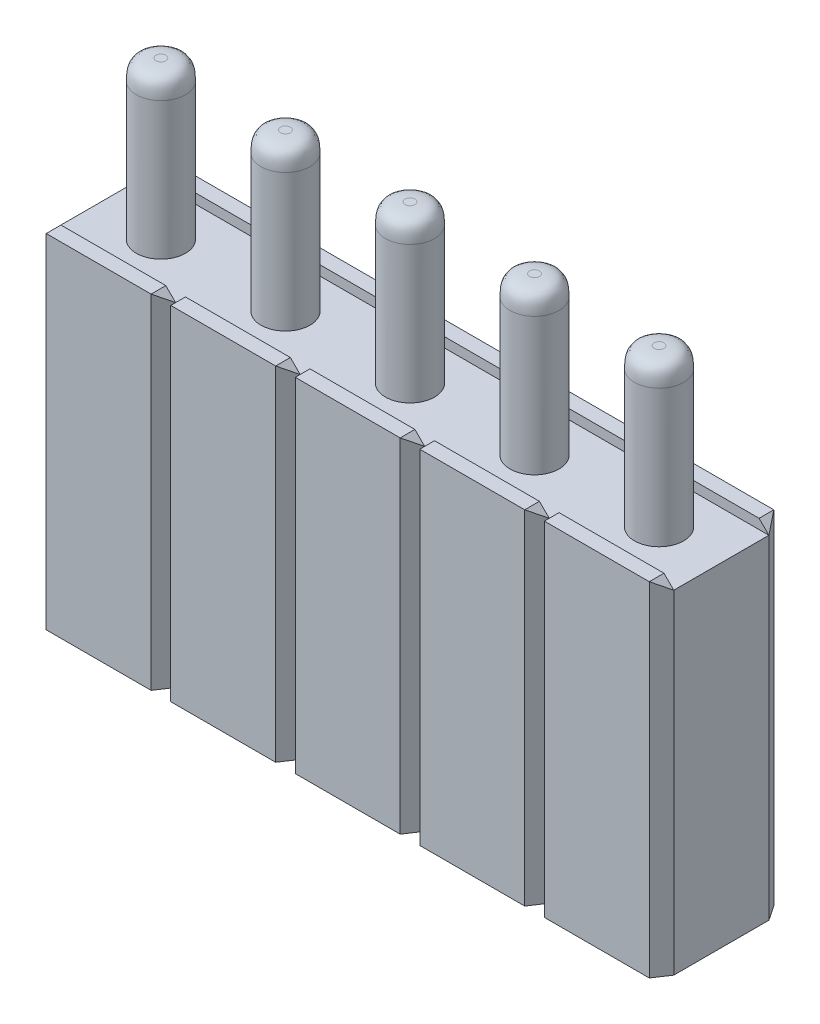
from build123d import *

# Parameters (mm, degrees)
BOSS_EXTRU_1_DEPTH      = 12.7
ENL_V_MAT_EXTRU_1_DEPTH = 14.416094812
ENL_V_MAT_EXTRU_2_DEPTH = 15.556884969
ESQUISSE4_R             = 0.51
ENL_V_MAT_EXTRU_3_DEPTH = 6
CHANFREIN1_SIZE         = 0.1
ESQUISSE5_R             = 0.5
BOSS_EXTRU_2_DEPTH      = 3.2
CONG_1_SIZE             = 0.4


with BuildPart() as part:
    # Esquisse1 → Boss.-Extru.1 (new body)
    with BuildSketch(Plane(origin=(0, 0, 0), x_dir=(0, 0, -1), z_dir=(1, 0, 0))):
        Polygon((-1.27, -3.5), (1.27, -3.5), (1.27, 3.5), (0.97, 3.5), (0.97, 3.3), (-0.97, 3.3), (-0.97, 3.5), (-1.27, 3.5), align=None)
    extrude(amount=BOSS_EXTRU_1_DEPTH)

    # Esquisse2 → Enlèv. mat.-Extru.1 (cut, through all)
    with BuildSketch(Plane.XY.offset(1.27)):
        Polygon((12.7, 3.5), (12.5, 3.5), (12.7, 3.3), align=None)
        Polygon((10.36, 3.5), (9.96, 3.5), (10.16, 3.3), align=None)
        Polygon((7.82, 3.5), (7.42, 3.5), (7.62, 3.3), align=None)
        Polygon((2.74, 3.5), (2.34, 3.5), (2.54, 3.3), align=None)
        Polygon((5.28, 3.5), (4.88, 3.5), (5.08, 3.3), align=None)
        Polygon((0, 3.5), (0, 3.3), (0.2, 3.5), align=None)
    extrude(amount=-ENL_V_MAT_EXTRU_1_DEPTH, mode=Mode.SUBTRACT)

    # Esquisse3 → Enlèv. mat.-Extru.2 (cut, through all)
    with BuildSketch(Plane.XZ.offset(3.5)):
        Polygon((0, 0.97), (0.2, 1.27), (0.2, 1.727152584), (-0.45, 1.27), (-0.355311801, 1.190631542), align=None)
        Polygon((2.34, 1.27), (2.54, 0.97), (2.74, 1.27), (2.55635952, 1.59453928), align=None)
        Polygon((-0.45, -1.27), (-0.125, -1.561564959), (0.2, -1.27), (0, -0.97), (-0.355311801, -1.190631542), align=None)
        Polygon((2.34, -1.27), (2.54, -1.492934883), (2.74, -1.27), (2.54, -0.97), align=None)
        Polygon((5.08, 0.97), (5.28, 1.27), (5.09635952, 1.59453928), (4.88, 1.27), align=None)
        Polygon((5.08, -1.492934883), (5.28, -1.27), (5.08, -0.97), (4.88, -1.27), align=None)
        Polygon((7.62, 0.97), (7.82, 1.27), (7.63635952, 1.59453928), (7.42, 1.27), align=None)
        Polygon((7.62, -1.492934883), (7.82, -1.27), (7.62, -0.97), (7.42, -1.27), align=None)
        Polygon((10.16, 0.97), (10.36, 1.27), (10.17635952, 1.59453928), (9.96, 1.27), align=None)
        Polygon((10.16, -1.492934883), (10.36, -1.27), (10.16, -0.97), (9.96, -1.27), align=None)
        Polygon((12.7, 0.97), (12.9, 1.27), (12.71635952, 1.59453928), (12.5, 1.27), align=None)
        Polygon((12.7, -1.492934883), (12.9, -1.27), (12.7, -0.97), (12.5, -1.27), align=None)
    extrude(amount=-ENL_V_MAT_EXTRU_2_DEPTH, mode=Mode.SUBTRACT)

    # Esquisse4 → Enlèv. mat.-Extru.3 (cut)
    with BuildSketch(Plane.XZ.offset(3.5)):
        with Locations(Location((1.27, 0, 0), (0, 0, 270))):
            Circle(ESQUISSE4_R)
        with Locations(Location((3.81, 0, 0), (0, 0, 270))):
            Circle(ESQUISSE4_R)
        with Locations(Location((6.35, 0, 0), (0, 0, 270))):
            Circle(ESQUISSE4_R)
        with Locations(Location((8.89, 0, 0), (0, 0, 270))):
            Circle(ESQUISSE4_R)
        with Locations(Location((11.43, 0, 0), (0, 0, 270))):
            Circle(ESQUISSE4_R)
    extrude(amount=-ENL_V_MAT_EXTRU_3_DEPTH, mode=Mode.SUBTRACT)

    # Chanfrein1
    chanfrein1_edges = [part.edges().sort_by_distance(p)[0] for p in [
        (1.27, -3.5, 0.51),
        (3.81, -3.5, 0.51),
        (6.35, -3.5, 0.51),
        (8.89, -3.5, 0.51),
        (11.43, -3.5, 0.51),
    ]]
    chamfer(chanfrein1_edges, length=CHANFREIN1_SIZE)

    # Esquisse5 → Boss.-Extru.2 (add)
    with BuildSketch(Plane(origin=(0, 3.3, 0), x_dir=(1, 0, 0), z_dir=(0, 1, 0))):
        with Locations(Location((1.27, 0, 0), (0, 0, 90))):
            Circle(ESQUISSE5_R)
        with Locations(Location((3.81, 0, 0), (0, 0, 90))):
            Circle(ESQUISSE5_R)
        with Locations(Location((6.35, 0, 0), (0, 0, 90))):
            Circle(ESQUISSE5_R)
        with Locations(Location((8.89, 0, 0), (0, 0, 90))):
            Circle(ESQUISSE5_R)
        with Locations(Location((11.43, 0, 0), (0, 0, 90))):
            Circle(ESQUISSE5_R)
    extrude(amount=BOSS_EXTRU_2_DEPTH)

    # Congé1
    # a fillet whose section is not a circle: 0.4 mm, written as the material it takes off along each edge
    with BuildSketch(Plane(origin=(1.27, 6.5, 0), x_dir=(0, 0, -1), z_dir=(1, 0, 0))) as cong_1_piece_1:
        with BuildLine():
            Bezier((0.5, -CONG_1_SIZE), (0.5, 0), (0.5 - CONG_1_SIZE, 0), weights=[1, 1.414213562, 1])
            Line((0.5 - CONG_1_SIZE, 0), (0.5, 0))
            Line((0.5, 0), (0.5, -CONG_1_SIZE))
        make_face()
    revolve(axis=Axis((1.27, 6.5, 0), (0, 1, 0)), mode=Mode.SUBTRACT)
    with BuildSketch(Plane(origin=(3.81, 6.5, 0), x_dir=(0, 0, -1), z_dir=(1, 0, 0))) as cong_1_piece_2:
        with BuildLine():
            Bezier((0.5, -CONG_1_SIZE), (0.5, 0), (0.5 - CONG_1_SIZE, 0), weights=[1, 1.414213562, 1])
            Line((0.5 - CONG_1_SIZE, 0), (0.5, 0))
            Line((0.5, 0), (0.5, -CONG_1_SIZE))
        make_face()
    revolve(axis=Axis((3.81, 6.5, 0), (0, 1, 0)), mode=Mode.SUBTRACT)
    with BuildSketch(Plane(origin=(6.35, 6.5, 0), x_dir=(0, 0, -1), z_dir=(1, 0, 0))) as cong_1_piece_3:
        with BuildLine():
            Bezier((0.5, -CONG_1_SIZE), (0.5, 0), (0.5 - CONG_1_SIZE, 0), weights=[1, 1.414213562, 1])
            Line((0.5 - CONG_1_SIZE, 0), (0.5, 0))
            Line((0.5, 0), (0.5, -CONG_1_SIZE))
        make_face()
    revolve(axis=Axis((6.35, 6.5, 0), (0, 1, 0)), mode=Mode.SUBTRACT)
    with BuildSketch(Plane(origin=(8.89, 6.5, 0), x_dir=(0, 0, -1), z_dir=(1, 0, 0))) as cong_1_piece_4:
        with BuildLine():
            Bezier((0.5, -CONG_1_SIZE), (0.5, 0), (0.5 - CONG_1_SIZE, 0), weights=[1, 1.414213562, 1])
            Line((0.5 - CONG_1_SIZE, 0), (0.5, 0))
            Line((0.5, 0), (0.5, -CONG_1_SIZE))
        make_face()
    revolve(axis=Axis((8.89, 6.5, 0), (0, 1, 0)), mode=Mode.SUBTRACT)
    with BuildSketch(Plane(origin=(11.43, 6.5, 0), x_dir=(0, 0, -1), z_dir=(1, 0, 0))) as cong_1_piece_5:
        with BuildLine():
            Bezier((0.5, -CONG_1_SIZE), (0.5, 0), (0.5 - CONG_1_SIZE, 0), weights=[1, 1.414213562, 1])
            Line((0.5 - CONG_1_SIZE, 0), (0.5, 0))
            Line((0.5, 0), (0.5, -CONG_1_SIZE))
        make_face()
    revolve(axis=Axis((11.43, 6.5, 0), (0, 1, 0)), mode=Mode.SUBTRACT)


solid = part.part
